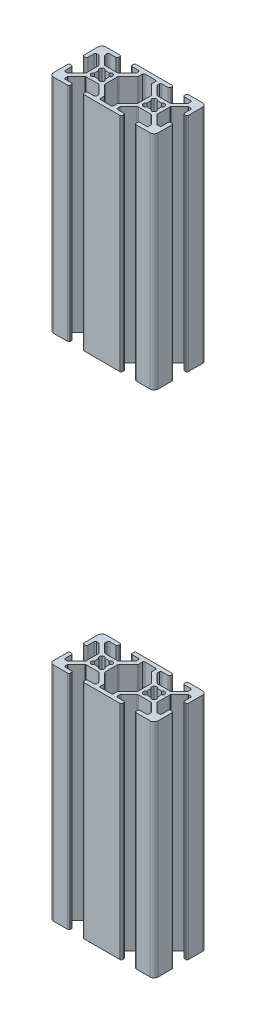
from build123d import *

# Parameters (mm, degrees)
EXTRUDE_1_DEPTH     = 140
SKETCH_2_W          = 40
SKETCH_2_H          = 110
CUT_EXTRUDE_1_DEPTH = 32


with BuildPart() as part:
    # 草图1 → 凸台-拉伸1 (new, symmetric)
    with BuildSketch(Plane(origin=(0, 0, 0), x_dir=(1, 0, 0), z_dir=(0, 1, 0))):
        with BuildLine():
            Line((-3.011929568, 5.856870214), (1.755909109, 5.856870214))
            ThreePointArc((1.755909109, 5.856870214), (1.950312292, 5.818201017), (2.115119353, 5.708080459))
            Line((2.115119353, 5.708080459), (5.218200015, 2.604999798))
            ThreePointArc((5.218200015, 2.604999798), (5.328320573, 2.440192737), (5.36698977, 2.245789553))
            Line((5.36698977, 2.245789553), (5.36698977, 1.519870214))
            ThreePointArc((5.36698977, 1.519870214), (5.218200015, 1.16065997), (4.85898977, 1.011870214))
            Line((4.85898977, 1.011870214), (2.50998977, 1.011870214))
            ThreePointArc((2.50998977, 1.011870214), (2.150779525, 0.863080459), (2.00198977, 0.503870214))
            Line((2.00198977, 0.503870214), (2.00198977, 0.019870214))
            ThreePointArc((2.00198977, 0.019870214), (2.150779525, -0.33934003), (2.50998977, -0.488129786))
            Line((2.50998977, -0.488129786), (16.23398977, -0.488129786))
            ThreePointArc((16.23398977, -0.488129786), (16.593200015, -0.33934003), (16.74198977, 0.019870214))
            Line((16.74198977, 0.019870214), (16.74198977, 0.503870214))
            ThreePointArc((16.74198977, 0.503870214), (16.593200015, 0.863080459), (16.23398977, 1.011870214))
            Line((16.23398977, 1.011870214), (13.88498977, 1.011870214))
            ThreePointArc((13.88498977, 1.011870214), (13.525779525, 1.16065997), (13.37698977, 1.519870214))
            Line((13.37698977, 1.519870214), (13.37698977, 2.245789553))
            ThreePointArc((13.37698977, 2.245789553), (13.415658968, 2.440192737), (13.525779525, 2.604999798))
            Line((13.525779525, 2.604999798), (16.628860187, 5.708080459))
            ThreePointArc((16.628860187, 5.708080459), (16.793667248, 5.818201017), (16.988070432, 5.856870214))
            Line((16.988070432, 5.856870214), (21.755909109, 5.856870214))
            ThreePointArc((21.755909109, 5.856870214), (21.950312292, 5.818201017), (22.115119353, 5.708080459))
            Line((22.115119353, 5.708080459), (25.218200015, 2.604999798))
            ThreePointArc((25.218200015, 2.604999798), (25.328320573, 2.440192737), (25.36698977, 2.245789553))
            Line((25.36698977, 2.245789553), (25.36698977, 1.519870214))
            ThreePointArc((25.36698977, 1.519870214), (25.218200015, 1.16065997), (24.85898977, 1.011870214))
            Line((24.85898977, 1.011870214), (22.50998977, 1.011870214))
            ThreePointArc((22.50998977, 1.011870214), (22.150779525, 0.863080459), (22.00198977, 0.503870214))
            Line((22.00198977, 0.503870214), (22.00198977, 0.019870214))
            ThreePointArc((22.00198977, 0.019870214), (22.150779525, -0.33934003), (22.50998977, -0.488129786))
            Line((22.50998977, -0.488129786), (27.87198977, -0.488129786))
            ThreePointArc((27.87198977, -0.488129786), (28.932649942, -0.048789957), (29.37198977, 1.011870214))
            Line((29.37198977, 1.011870214), (29.37198977, 6.373870214))
            ThreePointArc((29.37198977, 6.373870214), (29.223200015, 6.733080459), (28.86398977, 6.881870214))
            Line((28.86398977, 6.881870214), (28.37998977, 6.881870214))
            ThreePointArc((28.37998977, 6.881870214), (28.020779525, 6.733080459), (27.87198977, 6.373870214))
            Line((27.87198977, 6.373870214), (27.87198977, 4.024870214))
            ThreePointArc((27.87198977, 4.024870214), (27.723200015, 3.66565997), (27.36398977, 3.516870214))
            Line((27.36398977, 3.516870214), (26.638070432, 3.516870214))
            ThreePointArc((26.638070432, 3.516870214), (26.443667248, 3.555539412), (26.278860187, 3.66565997))
            Line((26.278860187, 3.66565997), (23.175779525, 6.768740631))
            ThreePointArc((23.175779525, 6.768740631), (23.065658968, 6.933547692), (23.02698977, 7.127950876))
            Line((23.02698977, 7.127950876), (23.02698977, 11.895789553))
            ThreePointArc((23.02698977, 11.895789553), (23.065658968, 12.090192737), (23.175779525, 12.254999798))
            Line((23.175779525, 12.254999798), (26.278860187, 15.358080459))
            ThreePointArc((26.278860187, 15.358080459), (26.443667248, 15.468201017), (26.638070432, 15.506870214))
            Line((26.638070432, 15.506870214), (27.36398977, 15.506870214))
            ThreePointArc((27.36398977, 15.506870214), (27.723200015, 15.358080459), (27.87198977, 14.998870214))
            Line((27.87198977, 14.998870214), (27.87198977, 12.649870214))
            ThreePointArc((27.87198977, 12.649870214), (28.020779525, 12.29065997), (28.37998977, 12.141870214))
            Line((28.37998977, 12.141870214), (28.86398977, 12.141870214))
            ThreePointArc((28.86398977, 12.141870214), (29.223200015, 12.29065997), (29.37198977, 12.649870214))
            Line((29.37198977, 12.649870214), (29.37198977, 18.011870214))
            ThreePointArc((29.37198977, 18.011870214), (28.932649942, 19.072530386), (27.87198977, 19.511870214))
            Line((27.87198977, 19.511870214), (22.50998977, 19.511870214))
            ThreePointArc((22.50998977, 19.511870214), (22.150779525, 19.363080459), (22.00198977, 19.003870214))
            Line((22.00198977, 19.003870214), (22.00198977, 18.519870214))
            ThreePointArc((22.00198977, 18.519870214), (22.150779525, 18.16065997), (22.50998977, 18.011870214))
            Line((22.50998977, 18.011870214), (24.85898977, 18.011870214))
            ThreePointArc((24.85898977, 18.011870214), (25.218200015, 17.863080459), (25.36698977, 17.503870214))
            Line((25.36698977, 17.503870214), (25.36698977, 16.777950876))
            ThreePointArc((25.36698977, 16.777950876), (25.328320573, 16.583547692), (25.218200015, 16.418740631))
            Line((25.218200015, 16.418740631), (22.115119353, 13.31565997))
            ThreePointArc((22.115119353, 13.31565997), (21.950312292, 13.205539412), (21.755909109, 13.166870214))
            Line((21.755909109, 13.166870214), (16.988070432, 13.166870214))
            ThreePointArc((16.988070432, 13.166870214), (16.793667248, 13.205539412), (16.628860187, 13.31565997))
            Line((16.628860187, 13.31565997), (13.525779525, 16.418740631))
            ThreePointArc((13.525779525, 16.418740631), (13.415658968, 16.583547692), (13.37698977, 16.777950876))
            Line((13.37698977, 16.777950876), (13.37698977, 17.503870214))
            ThreePointArc((13.37698977, 17.503870214), (13.525779525, 17.863080459), (13.88498977, 18.011870214))
            Line((13.88498977, 18.011870214), (16.23398977, 18.011870214))
            ThreePointArc((16.23398977, 18.011870214), (16.593200015, 18.16065997), (16.74198977, 18.519870214))
            Line((16.74198977, 18.519870214), (16.74198977, 19.003870214))
            ThreePointArc((16.74198977, 19.003870214), (16.593200015, 19.363080459), (16.23398977, 19.511870214))
            Line((16.23398977, 19.511870214), (2.50998977, 19.511870214))
            ThreePointArc((2.50998977, 19.511870214), (2.150779525, 19.363080459), (2.00198977, 19.003870214))
            Line((2.00198977, 19.003870214), (2.00198977, 18.519870214))
            ThreePointArc((2.00198977, 18.519870214), (2.150779525, 18.16065997), (2.50998977, 18.011870214))
            Line((2.50998977, 18.011870214), (4.85898977, 18.011870214))
            ThreePointArc((4.85898977, 18.011870214), (5.218200015, 17.863080459), (5.36698977, 17.503870214))
            Line((5.36698977, 17.503870214), (5.36698977, 16.777950876))
            ThreePointArc((5.36698977, 16.777950876), (5.328320573, 16.583547692), (5.218200015, 16.418740631))
            Line((5.218200015, 16.418740631), (2.115119353, 13.31565997))
            ThreePointArc((2.115119353, 13.31565997), (1.950312292, 13.205539412), (1.755909109, 13.166870214))
            Line((1.755909109, 13.166870214), (-3.011929568, 13.166870214))
            ThreePointArc((-3.011929568, 13.166870214), (-3.206332752, 13.205539412), (-3.371139813, 13.31565997))
            Line((-3.371139813, 13.31565997), (-6.474220475, 16.418740631))
            ThreePointArc((-6.474220475, 16.418740631), (-6.584341032, 16.583547692), (-6.62301023, 16.777950876))
            Line((-6.62301023, 16.777950876), (-6.62301023, 17.503870214))
            ThreePointArc((-6.62301023, 17.503870214), (-6.474220475, 17.863080459), (-6.11501023, 18.011870214))
            Line((-6.11501023, 18.011870214), (-3.76601023, 18.011870214))
            ThreePointArc((-3.76601023, 18.011870214), (-3.406799985, 18.16065997), (-3.25801023, 18.519870214))
            Line((-3.25801023, 18.519870214), (-3.25801023, 19.003870214))
            ThreePointArc((-3.25801023, 19.003870214), (-3.406799985, 19.363080459), (-3.76601023, 19.511870214))
            Line((-3.76601023, 19.511870214), (-9.12801023, 19.511870214))
            ThreePointArc((-9.12801023, 19.511870214), (-10.188670402, 19.072530386), (-10.62801023, 18.011870214))
            Line((-10.62801023, 18.011870214), (-10.62801023, 12.649870214))
            ThreePointArc((-10.62801023, 12.649870214), (-10.479220475, 12.29065997), (-10.12001023, 12.141870214))
            Line((-10.12001023, 12.141870214), (-9.63601023, 12.141870214))
            ThreePointArc((-9.63601023, 12.141870214), (-9.276799985, 12.29065997), (-9.12801023, 12.649870214))
            Line((-9.12801023, 12.649870214), (-9.12801023, 14.998870214))
            ThreePointArc((-9.12801023, 14.998870214), (-8.979220475, 15.358080459), (-8.62001023, 15.506870214))
            Line((-8.62001023, 15.506870214), (-7.894090891, 15.506870214))
            ThreePointArc((-7.894090891, 15.506870214), (-7.699687708, 15.468201017), (-7.534880647, 15.358080459))
            Line((-7.534880647, 15.358080459), (-4.431799985, 12.254999798))
            ThreePointArc((-4.431799985, 12.254999798), (-4.321679427, 12.090192737), (-4.28301023, 11.895789553))
            Line((-4.28301023, 11.895789553), (-4.28301023, 7.127950876))
            ThreePointArc((-4.28301023, 7.127950876), (-4.321679427, 6.933547692), (-4.431799985, 6.768740631))
            Line((-4.431799985, 6.768740631), (-7.534880647, 3.66565997))
            ThreePointArc((-7.534880647, 3.66565997), (-7.699687708, 3.555539412), (-7.894090891, 3.516870214))
            Line((-7.894090891, 3.516870214), (-8.62001023, 3.516870214))
            ThreePointArc((-8.62001023, 3.516870214), (-8.979220475, 3.66565997), (-9.12801023, 4.024870214))
            Line((-9.12801023, 4.024870214), (-9.12801023, 6.373870214))
            ThreePointArc((-9.12801023, 6.373870214), (-9.276799985, 6.733080459), (-9.63601023, 6.881870214))
            Line((-9.63601023, 6.881870214), (-10.12001023, 6.881870214))
            ThreePointArc((-10.12001023, 6.881870214), (-10.479220475, 6.733080459), (-10.62801023, 6.373870214))
            Line((-10.62801023, 6.373870214), (-10.62801023, 1.011870214))
            ThreePointArc((-10.62801023, 1.011870214), (-10.188670402, -0.048789957), (-9.12801023, -0.488129786))
            Line((-9.12801023, -0.488129786), (-3.76601023, -0.488129786))
            ThreePointArc((-3.76601023, -0.488129786), (-3.406799985, -0.33934003), (-3.25801023, 0.019870214))
            Line((-3.25801023, 0.019870214), (-3.25801023, 0.503870214))
            ThreePointArc((-3.25801023, 0.503870214), (-3.406799985, 0.863080459), (-3.76601023, 1.011870214))
            Line((-3.76601023, 1.011870214), (-6.11501023, 1.011870214))
            ThreePointArc((-6.11501023, 1.011870214), (-6.474220475, 1.16065997), (-6.62301023, 1.519870214))
            Line((-6.62301023, 1.519870214), (-6.62301023, 2.245789553))
            ThreePointArc((-6.62301023, 2.245789553), (-6.584341032, 2.440192737), (-6.474220475, 2.604999798))
            Line((-6.474220475, 2.604999798), (-3.371139813, 5.708080459))
            ThreePointArc((-3.371139813, 5.708080459), (-3.206332752, 5.818201017), (-3.011929568, 5.856870214))
        make_face()
        with BuildLine():
            Line((17.247088926, 7.207364248), (17.067483804, 7.386969371))
            ThreePointArc((17.067483804, 7.386969371), (16.866051753, 8.155402404), (17.436856264, 8.707893496))
            ThreePointArc((17.436856264, 8.707893496), (17.27648977, 9.511870214), (17.436856264, 10.315846932))
            ThreePointArc((17.436856264, 10.315846932), (16.866051753, 10.868338025), (17.067483804, 11.636771058))
            Line((17.067483804, 11.636771058), (17.247088926, 11.816376181))
            ThreePointArc((17.247088926, 11.816376181), (18.015521959, 12.017808231), (18.568013052, 11.447003721))
            ThreePointArc((18.568013052, 11.447003721), (19.37198977, 11.607370214), (20.175966488, 11.447003721))
            ThreePointArc((20.175966488, 11.447003721), (20.728457581, 12.017808231), (21.496890614, 11.816376181))
            Line((21.496890614, 11.816376181), (21.676495736, 11.636771058))
            ThreePointArc((21.676495736, 11.636771058), (21.877927787, 10.868338025), (21.307123276, 10.315846932))
            ThreePointArc((21.307123276, 10.315846932), (21.46748977, 9.511870214), (21.307123276, 8.707893496))
            ThreePointArc((21.307123276, 8.707893496), (21.877927787, 8.155402404), (21.676495736, 7.386969371))
            Line((21.676495736, 7.386969371), (21.496890614, 7.207364248))
            ThreePointArc((21.496890614, 7.207364248), (20.728457581, 7.005932198), (20.175966488, 7.576736708))
            ThreePointArc((20.175966488, 7.576736708), (19.37198977, 7.416370214), (18.568013052, 7.576736708))
            ThreePointArc((18.568013052, 7.576736708), (18.015521959, 7.005932198), (17.247088926, 7.207364248))
        make_face(mode=Mode.SUBTRACT)
        with BuildLine():
            Line((6.86698977, 1.519870214), (6.86698977, 2.867109897))
            ThreePointArc((6.86698977, 2.867109897), (6.828320573, 3.06151308), (6.718200015, 3.226320141))
            Line((6.718200015, 3.226320141), (3.175779525, 6.768740631))
            ThreePointArc((3.175779525, 6.768740631), (3.065658968, 6.933547692), (3.02698977, 7.127950876))
            Line((3.02698977, 7.127950876), (3.02698977, 11.895789553))
            ThreePointArc((3.02698977, 11.895789553), (3.065658968, 12.090192737), (3.175779525, 12.254999798))
            Line((3.175779525, 12.254999798), (6.718200015, 15.797420287))
            ThreePointArc((6.718200015, 15.797420287), (6.828320573, 15.962227349), (6.86698977, 16.156630532))
            Line((6.86698977, 16.156630532), (6.86698977, 17.503870214))
            ThreePointArc((6.86698977, 17.503870214), (7.015779525, 17.863080459), (7.37498977, 18.011870214))
            Line((7.37498977, 18.011870214), (11.36898977, 18.011870214))
            ThreePointArc((11.36898977, 18.011870214), (11.728200015, 17.863080459), (11.87698977, 17.503870214))
            Line((11.87698977, 17.503870214), (11.87698977, 16.156630532))
            ThreePointArc((11.87698977, 16.156630532), (11.915658968, 15.962227349), (12.025779525, 15.797420287))
            Line((12.025779525, 15.797420287), (15.568200015, 12.254999798))
            ThreePointArc((15.568200015, 12.254999798), (15.678320573, 12.090192737), (15.71698977, 11.895789553))
            Line((15.71698977, 11.895789553), (15.71698977, 7.127950876))
            ThreePointArc((15.71698977, 7.127950876), (15.678320573, 6.933547692), (15.568200015, 6.768740631))
            Line((15.568200015, 6.768740631), (12.025779525, 3.226320141))
            ThreePointArc((12.025779525, 3.226320141), (11.915658968, 3.06151308), (11.87698977, 2.867109897))
            Line((11.87698977, 2.867109897), (11.87698977, 1.519870214))
            ThreePointArc((11.87698977, 1.519870214), (11.728200015, 1.16065997), (11.36898977, 1.011870214))
            Line((11.36898977, 1.011870214), (7.37498977, 1.011870214))
            ThreePointArc((7.37498977, 1.011870214), (7.015779525, 1.16065997), (6.86698977, 1.519870214))
        make_face(mode=Mode.SUBTRACT)
        with BuildLine():
            Line((-2.752911074, 7.207364248), (-2.932516196, 7.386969371))
            ThreePointArc((-2.932516196, 7.386969371), (-3.133948247, 8.155402404), (-2.563143736, 8.707893496))
            ThreePointArc((-2.563143736, 8.707893496), (-2.72351023, 9.511870214), (-2.563143736, 10.315846932))
            ThreePointArc((-2.563143736, 10.315846932), (-3.133948247, 10.868338025), (-2.932516196, 11.636771058))
            Line((-2.932516196, 11.636771058), (-2.752911074, 11.816376181))
            ThreePointArc((-2.752911074, 11.816376181), (-1.984478041, 12.017808231), (-1.431986948, 11.447003721))
            ThreePointArc((-1.431986948, 11.447003721), (-0.62801023, 11.607370214), (0.175966488, 11.447003721))
            ThreePointArc((0.175966488, 11.447003721), (0.728457581, 12.017808231), (1.496890614, 11.816376181))
            Line((1.496890614, 11.816376181), (1.676495736, 11.636771058))
            ThreePointArc((1.676495736, 11.636771058), (1.877927787, 10.868338025), (1.307123276, 10.315846932))
            ThreePointArc((1.307123276, 10.315846932), (1.46748977, 9.511870214), (1.307123276, 8.707893496))
            ThreePointArc((1.307123276, 8.707893496), (1.877927787, 8.155402404), (1.676495736, 7.386969371))
            Line((1.676495736, 7.386969371), (1.496890614, 7.207364248))
            ThreePointArc((1.496890614, 7.207364248), (0.728457581, 7.005932198), (0.175966488, 7.576736708))
            ThreePointArc((0.175966488, 7.576736708), (-0.62801023, 7.416370214), (-1.431986948, 7.576736708))
            ThreePointArc((-1.431986948, 7.576736708), (-1.984478041, 7.005932198), (-2.752911074, 7.207364248))
        make_face(mode=Mode.SUBTRACT)
    extrude(amount=EXTRUDE_1_DEPTH, both=True)

    # 草图2 → 切除-拉伸1 (cut)
    with BuildSketch(Plane(origin=(0, 0, -19.511870214), x_dir=(-1, 0, 0), z_dir=(0, 0, -1))):
        with Locations((-9.37198977, 0)):
            Rectangle(SKETCH_2_W, SKETCH_2_H)
    extrude(amount=-CUT_EXTRUDE_1_DEPTH, mode=Mode.SUBTRACT)


with BuildPart() as cut_extrude_1_piece_1:
    # of the separate pieces the step leaves, piece 1, a body of its own (cut_extrude_1_pieces)
    add(part.part.solids().sort_by_distance((-3.76601023, 140, -18.011870214))[0])


with BuildPart() as cut_extrude_1_piece_2:
    # of the separate pieces the step leaves, piece 2, a body of its own (cut_extrude_1_pieces)
    add(part.part.solids().sort_by_distance((-3.76601023, -55, -18.011870214))[0])


solid = Compound([cut_extrude_1_piece_1.part, cut_extrude_1_piece_2.part])
